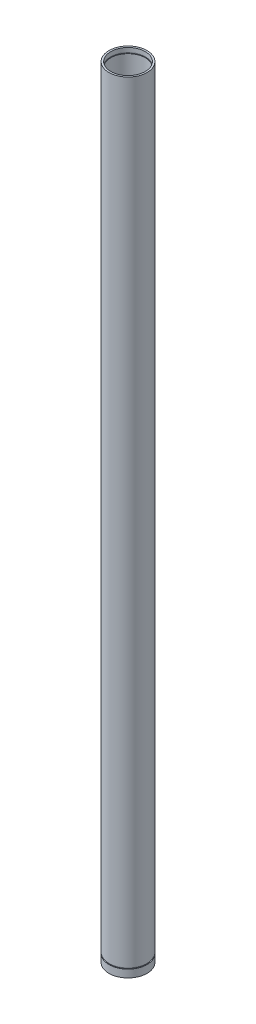
from build123d import *

# Parameters (mm, degrees)
SKETCH1_R           = 27.1145
SKETCH1_R_2         = 24.5745
BOSS_EXTRUDE1_DEPTH = 1111.25
SKETCH2_W           = 2.54
SKETCH2_H           = 1.397
SKETCH11_W          = 1.733241038
SKETCH11_H          = 1.524


with BuildPart() as part:
    # Sketch1 → Boss-Extrude1 (new body)
    with BuildSketch(Plane(origin=(0, 0, 0), x_dir=(1, 0, 0), z_dir=(0, 1, 0))):
        Circle(SKETCH1_R)
        Circle(SKETCH1_R_2, mode=Mode.SUBTRACT)
    extrude(amount=BOSS_EXTRUDE1_DEPTH)

    # Sketch2 → Cut-Revolve1 (revolve, cut)
    with BuildSketch(Plane.XY):
        with Locations((24.0665, 6.9215)):
            Rectangle(SKETCH2_W, SKETCH2_H)
    cut_revolve1 = revolve(axis=Axis((0, 1111.25, 0), (0, -1, 0)), mode=Mode.SUBTRACT)

    # Mirror1: Cut-Revolve1 across plane
    add(cut_revolve1.mirror(Plane(origin=(0, 555.625, 0), x_dir=(0, 0, 1), z_dir=(0, -1, 0))), mode=Mode.SUBTRACT)

    # Sketch11 → Cut-Revolve3 (revolve, cut)
    with BuildSketch(Plane.XY):
        with Locations((26.838120519, 11.684)):
            Rectangle(SKETCH11_W, SKETCH11_H)
    revolve(axis=Axis((0, 1111.25, 0), (0, -1, 0)), mode=Mode.SUBTRACT)


solid = part.part
